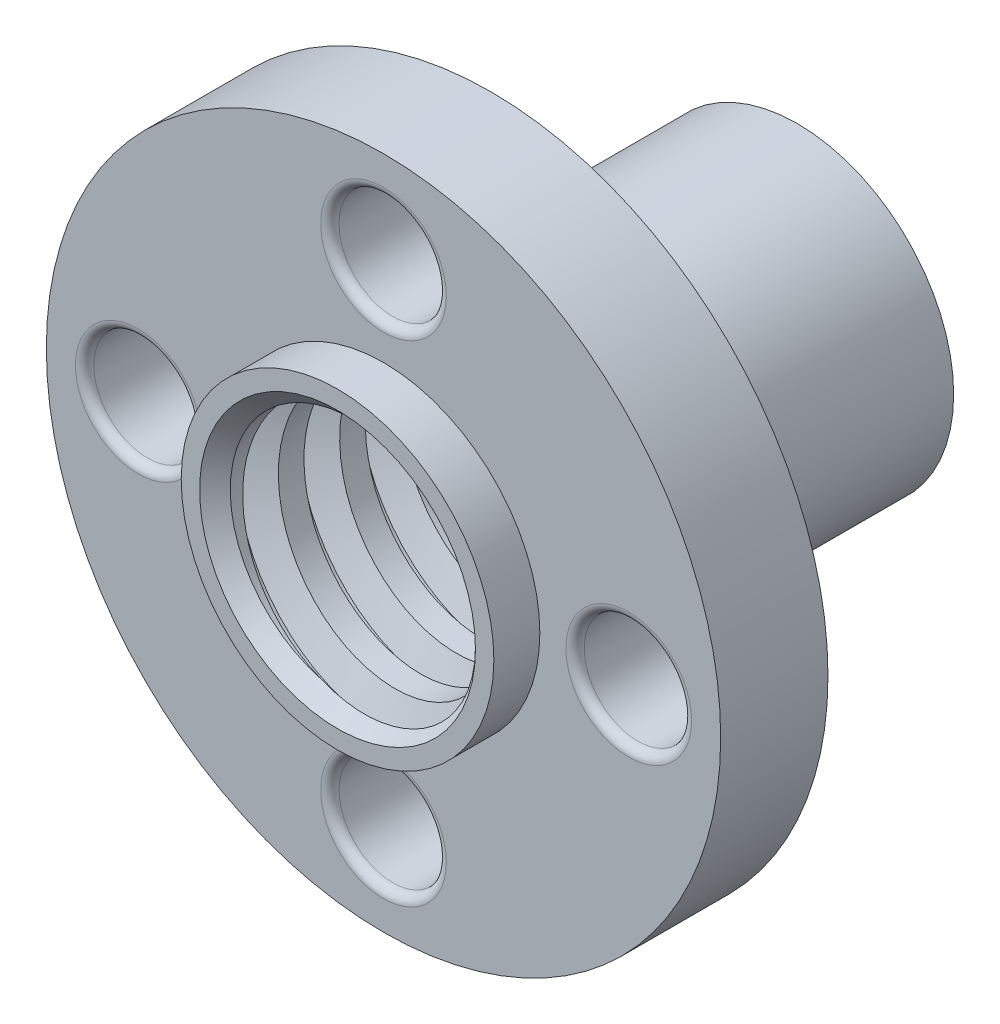
from build123d import *

# Parameters (mm, degrees)
SKETCH1_R                = 11
SKETCH1_R_2              = 5.1
SKETCH1_R_3              = 1.75
BOSS_EXTRUDE1_DEPTH      = 3.5
BOSS_EXTRUDE2_DEPTH      = 1.5
BOSS_EXTRUDE2_DEPTH_BACK = 13.5
SKETCH2_R                = 5.1
SKETCH2_R_2              = 4
CHAMFER1_SIZE            = 0.5
CUT_SWEEP1_PITCH         = 2
FILLET2_R                = 0.3


with BuildPart() as part:
    # Sketch1 → Boss-Extrude1 (new body)
    with BuildSketch(Plane.XY):
        Circle(SKETCH1_R)
        Circle(SKETCH1_R_2, mode=Mode.SUBTRACT)
        with Locations((0, 8)):
            Circle(SKETCH1_R_3, mode=Mode.SUBTRACT)
        with Locations((8, 0)):
            Circle(SKETCH1_R_3, mode=Mode.SUBTRACT)
        with Locations((0, -8)):
            Circle(SKETCH1_R_3, mode=Mode.SUBTRACT)
        with Locations((-8, 0)):
            Circle(SKETCH1_R_3, mode=Mode.SUBTRACT)
    extrude(amount=-BOSS_EXTRUDE1_DEPTH)

    # Sketch2 → Boss-Extrude2 (add, two sides: drawn at the far end of the back side and taken through both)
    with BuildSketch(Plane.XY.offset(-BOSS_EXTRUDE2_DEPTH_BACK)):
        Circle(SKETCH2_R)
        Circle(SKETCH2_R_2, mode=Mode.SUBTRACT)
    extrude(amount=BOSS_EXTRUDE2_DEPTH + BOSS_EXTRUDE2_DEPTH_BACK)

    # Chamfer1
    chamfer1_edges = [part.edges().sort_by_distance(p)[0] for p in [
        (-4, 0, -13.5),
        (-4, 0, 1.5),
    ]]
    chamfer(chamfer1_edges, length=CHAMFER1_SIZE)

    # Cut-Sweep1: arcs per turn and ends read off the stored shape
    # Cut-Sweep1: the profile of Sketch4 screwed along a right-hand helix through 8.5 turns, 10 arcs to a turn; built about Z, then put on its axis
    cut_sweep1_z = Axis((0, 0, 0), (0, 0, 1))
    cut_sweep1_corners = [(3, 0, 1.45), (3, 0, -0.45), (5, 0, 0.285411185), (5, 0, 0.714588815)]
    with BuildLine(mode=Mode.PRIVATE) as cut_sweep1_profile:
        Line(cut_sweep1_corners[0], cut_sweep1_corners[1])
        Line(cut_sweep1_corners[1], cut_sweep1_corners[2])
        Line(cut_sweep1_corners[2], cut_sweep1_corners[3])
        Line(cut_sweep1_corners[3], cut_sweep1_corners[0])
    cut_sweep1_cap = Face(cut_sweep1_profile.wire())
    cut_sweep1_turn_angles = [0, 18, 36, 54, 72, 90, 108, 126, 144, 162, 180, 198, 216, 234, 252, 270, 288, 306, 324, 342, 360]
    cut_sweep1_turn_weights = [1, 0.9510565162951535, 1, 0.9510565162951535, 1, 0.9510565162951535, 1, 0.9510565162951535, 1, 0.9510565162951535, 1, 0.9510565162951535, 1, 0.9510565162951535, 1, 0.9510565162951535, 1, 0.9510565162951535, 1, 0.9510565162951535, 1]
    cut_sweep1_turn_rails = [Edge.make_bspline([Vector(p[0], p[1], 0).rotate(cut_sweep1_z, cut_sweep1_turn_angles[k]) / cut_sweep1_turn_weights[k] + Vector(0, 0, p[2] + CUT_SWEEP1_PITCH * cut_sweep1_turn_angles[k] / 360) for k in range(21)], [0, 0, 0, 1, 1, 2, 2, 3, 3, 4, 4, 5, 5, 6, 6, 7, 7, 8, 8, 9, 9, 10, 10, 10], 2, cut_sweep1_turn_weights) for p in cut_sweep1_corners]
    cut_sweep1_turn_sides = [Face.make_surface_from_curves(cut_sweep1_turn_rails[p[0]], cut_sweep1_turn_rails[p[1]]) for p in [(0, 1), (1, 2), (2, 3), (3, 0)]]
    cut_sweep1_last_angles = [2880, 2898, 2916, 2934, 2952, 2970, 2988, 3006, 3024, 3042, 3060]
    cut_sweep1_last_weights = [1, 0.9510565162951535, 1, 0.9510565162951535, 1, 0.9510565162951535, 1, 0.9510565162951535, 1, 0.9510565162951671, 1]
    cut_sweep1_last_rails = [Edge.make_bspline([Vector(p[0], p[1], 0).rotate(cut_sweep1_z, cut_sweep1_last_angles[k]) / cut_sweep1_last_weights[k] + Vector(0, 0, p[2] + CUT_SWEEP1_PITCH * cut_sweep1_last_angles[k] / 360) for k in range(11)], [0, 0, 0, 1, 1, 2, 2, 3, 3, 4, 4, 5, 5, 5], 2, cut_sweep1_last_weights) for p in cut_sweep1_corners]
    cut_sweep1_last_sides = [Face.make_surface_from_curves(cut_sweep1_last_rails[p[0]], cut_sweep1_last_rails[p[1]]) for p in [(0, 1), (1, 2), (2, 3), (3, 0)]]
    cut_sweep1 = Plane(origin=(0, 0, 1.5), x_dir=(1, 0, 0), z_dir=(0, 0, -1)) * Solid(Shell([*[p.moved(Location((0, 0, CUT_SWEEP1_PITCH * i))) for i in range(8) for p in cut_sweep1_turn_sides], *cut_sweep1_last_sides, cut_sweep1_cap, cut_sweep1_cap.rotate(cut_sweep1_z, 3060).moved(Location((0, 0, CUT_SWEEP1_PITCH * 3060 / 360)))]))
    add(cut_sweep1, mode=Mode.SUBTRACT)

    # Fillet2
    fillet2_edges = [part.edges().sort_by_distance(p)[0] for p in [
        (6.25, 0, 0),
        (-1.75, -8, 0),
        (-9.75, 0, 0),
        (-1.75, 8, 0),
    ]]
    fillet(fillet2_edges, radius=FILLET2_R)


solid = part.part
